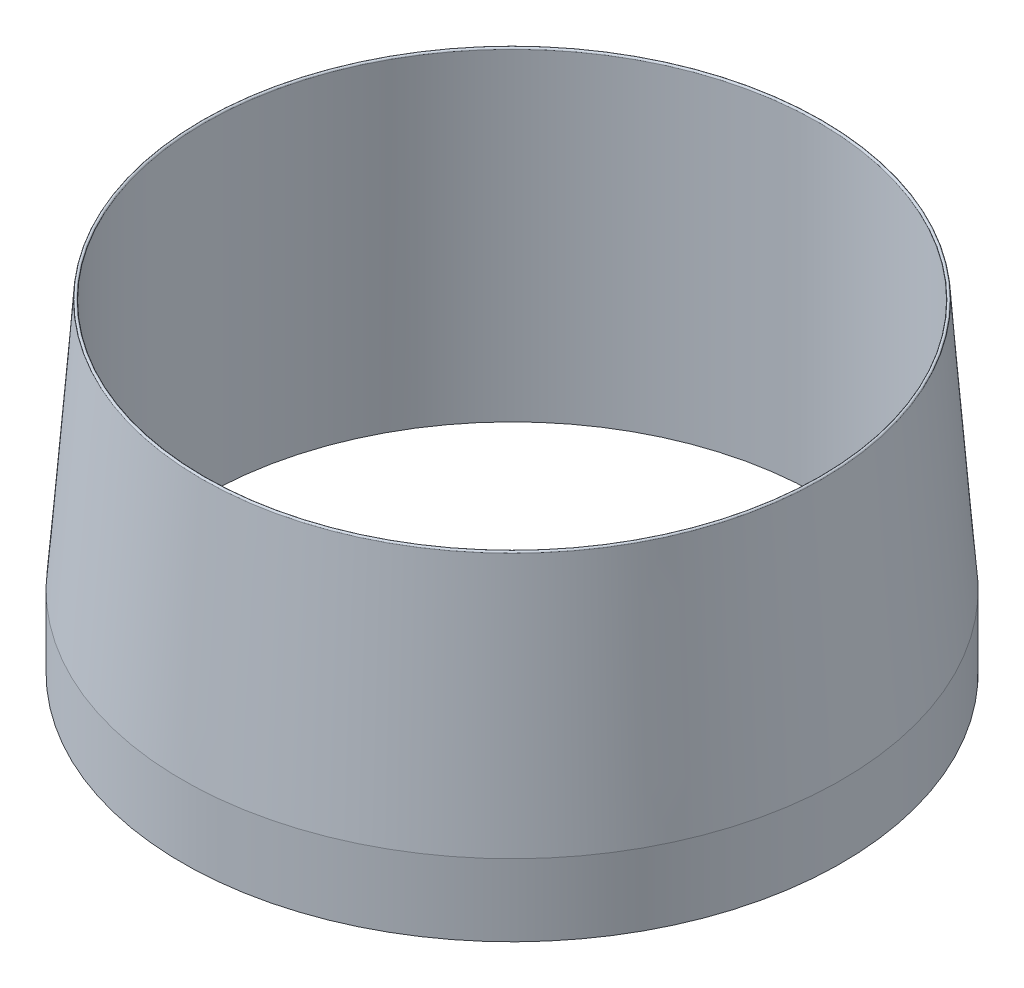
from build123d import *

# Parameters (mm, degrees)
FILLET1_R = 0.127


with BuildPart() as part:
    # Sketch1 → Revolve1 (revolve)
    with BuildSketch(Plane.XY):
        Polygon((27.1145, 0), (29.083, 0), (29.083, 6.35), (27.1145, 31.75), align=None)
    revolve(axis=Axis((0, -0.9525, 0), (0, 1, 0)))

    # Fillet1
    fillet1_edges = [part.edges().sort_by_distance(p)[0] for p in [
        (-27.1145, 31.75, 0),
    ]]
    fillet(fillet1_edges, radius=FILLET1_R)


solid = part.part
